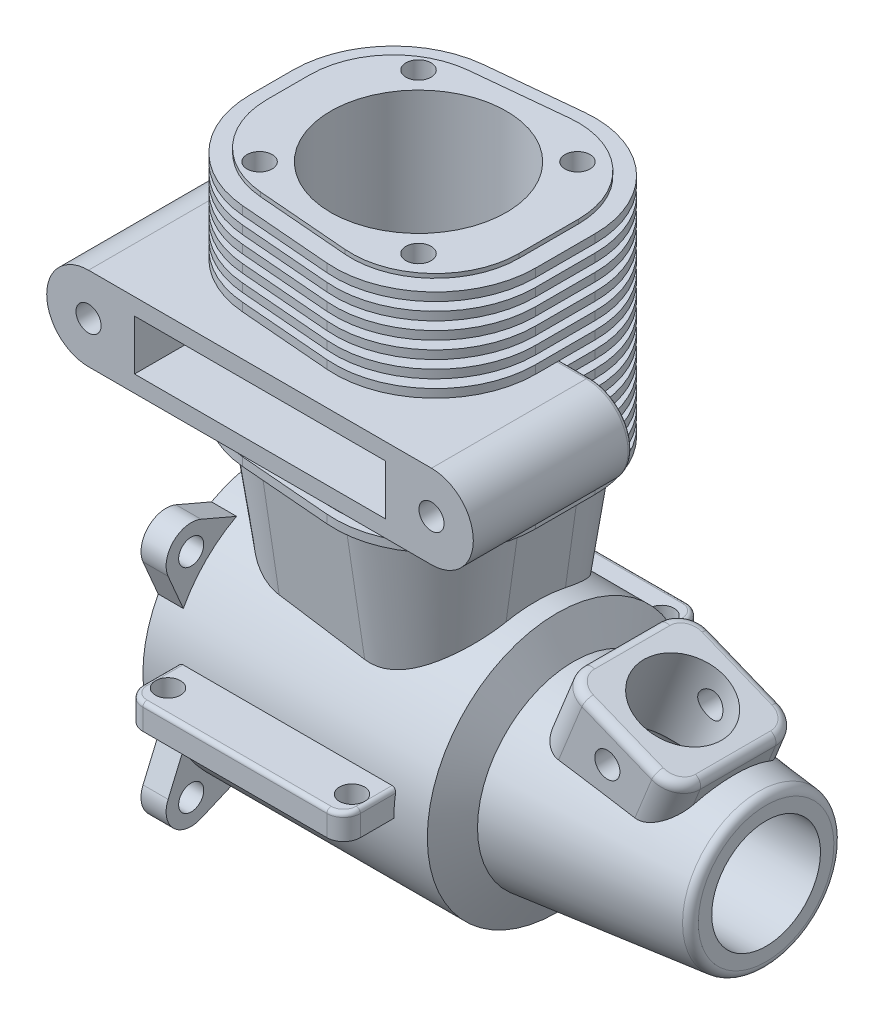
from build123d import *

# Parameters (mm, degrees)
BOSS_EXTRUDE1_DEPTH     = 28
CUT_EXTRUDE1_DEPTH      = 0.5
CUT_EXTRUDE2_DEPTH      = 1
LPATTERN1_COUNT         = 14
LPATTERN1_PITCH         = 2
BOSS_EXTRUDE2_DEPTH     = 20
BOSS_EXTRUDE2_TAPER     = 8.000000000000018
CUT_EXTRUDE3_REACH      = 113.479
CUT_EXTRUDE3_START      = -30
SKETCH6_R               = 14
CUT_EXTRUDE4_REACH      = 79.086
CUT_EXTRUDE4_END_RADIUS = 14
SKETCH7_R               = 10.5
BOSS_EXTRUDE3_DEPTH     = 7.5
CUT_EXTRUDE5_REACH      = 83.479
SKETCH9_R               = 6.5
CUT_EXTRUDE6_REACH      = 55.437
CUT_EXTRUDE6_END_RADIUS = 6.500000000000001
SKETCH10_R              = 5.000000000000001
SKETCH11_R              = 1.5000000000000009
CUT_EXTRUDE7_DEPTH      = 15
BOSS_EXTRUDE4_START     = -3
SKETCH12_R              = 1.5000000000000016
BOSS_EXTRUDE4_DEPTH     = 3
CIRPATTERN1_COUNT       = 4
SKETCH13_W              = 26
SKETCH13_H              = 10.000000000000002
SKETCH13_R              = 1.5000000000000009
SKETCH13_R_2            = 1.499999999999999
BOSS_EXTRUDE5_DEPTH     = 3
CUT_EXTRUDE8_START      = -29
SKETCH14_R              = 14
CUT_EXTRUDE8_DEPTH      = 29
SKETCH15_R              = 1.5000000000000009
SKETCH15_R_2            = 1.4999999999999998
CUT_EXTRUDE9_DEPTH      = 17
BOSS_EXTRUDE6_DEPTH     = 25.5
CUT_EXTRUDE10_REACH     = 79.217
SKETCH19_R              = 1.5000000000000009
CUT_EXTRUDE11_DEPTH     = 19
SKETCH21_R              = 10.5
CUT_EXTRUDE12_DEPTH     = 30
FILLET1_R               = 2
FILLET2_R               = 3
FILLET3_R               = 1
FILLET4_R               = 0.5


with BuildPart() as part:
    # Sketch1 → Revolve1 (revolve)
    with BuildSketch(Plane.XY, mode=Mode.PRIVATE) as revolve1_sk:
        Polygon((29.5, 0), (-29.5, 0), (-29.5, 15.5), (4.5000000000000036, 15.5), (6.499999999999998, 11.5), (29.5, 9), align=None)
    revolve(revolve1_sk.sketch.rotate(Axis((-35, 0, 0), (1, 1.8e-16, 0)), 180), axis=Axis((-35, 0, 0), (1, 1.8e-16, 0)))



with BuildPart() as body_2:
    # Sketch2 → Boss-Extrude1 (new body)
    with BuildSketch(Plane(origin=(0, 26, 0), x_dir=(1, 0, 0), z_dir=(0, 1, 0))):
        with BuildLine():
            Line((5.500000000000006, -3.549349969409107), (5.500000000000006, 3.549349969409107))
            ThreePointArc((5.500000000000007, 3.549349969409107), (1.5516451245829348, 12.447159294618313), (-7.69516846462998, 15.489683814873981))
            Line((-7.69516846462998, 15.489683814873981), (-18.69516846462999, 14.388638125441835))
            ThreePointArc((-18.69516846462999, 14.388638125441835), (-26.39780932520921, 10.49994940455989), (-29.5, 2.4483042799769623))
            Line((-29.5, 2.4483042799769623), (-29.500000000000007, -2.6511662818435284))
            ThreePointArc((-29.500000000000007, -2.6511662818435298), (-26.323804145032504, -10.783846062217727), (-18.476586598315457, -14.611361874558169))
            Line((-18.476586598315457, -14.611361874558165), (-7.4765865983154525, -15.509545562123746))
            ThreePointArc((-7.4765865983154525, -15.509545562123744), (1.6326797803741968, -12.373154114441608), (5.500000000000007, -3.549349969409107))
        make_face()
    extrude(amount=BOSS_EXTRUDE1_DEPTH)

    # Sketch3 → Cut-Extrude1 (cut)
    with BuildSketch(Plane(origin=(0, 54, 0), x_dir=(1, 0, 0), z_dir=(0, 1, 0))):
        with BuildLine():
            Line((-29.500000000000004, 2.4483042799769623), (-29.500000000000004, -2.6511662818435284))
            ThreePointArc((-29.500000000000004, -2.6511662818435284), (-26.323804145032504, -10.783846062217727), (-18.476586598315457, -14.611361874558165))
            Line((-18.476586598315457, -14.611361874558165), (-7.476586598315453, -15.509545562123742))
            ThreePointArc((-7.476586598315453, -15.509545562123742), (1.632679780374196, -12.373154114441608), (5.500000000000002, -3.549349969409108))
            Line((5.500000000000002, -3.549349969409108), (5.500000000000005, 3.5493499694091075))
            ThreePointArc((5.500000000000005, 3.5493499694091075), (1.5516451245829357, 12.447159294618313), (-7.6951684646299805, 15.489683814873983))
            Line((-7.6951684646299805, 15.489683814873983), (-18.69516846462999, 14.388638125441837))
            ThreePointArc((-18.69516846462999, 14.388638125441837), (-26.397809325209206, 10.499949404559894), (-29.500000000000004, 2.4483042799769623))
        make_face()
        with BuildLine():
            Line((-27.500000000000004, 2.4483042799769623), (-27.500000000000004, -2.651166281843529))
            ThreePointArc((-27.500000000000004, -2.651166281843529), (-24.85317012086042, -9.42839943215536), (-18.31382216526288, -12.617995942439057))
            Line((-18.31382216526288, -12.617995942439057), (-7.3138221652628745, -13.516179630004636))
            ThreePointArc((-7.3138221652628745, -13.516179630004636), (0.27723315031183215, -10.902520090269524), (3.5000000000000013, -3.5493499694091106))
            Line((3.5000000000000013, -3.5493499694091106), (3.500000000000005, 3.5493499694091075))
            ThreePointArc((3.500000000000005, 3.5493499694091075), (0.2097042704857799, 10.964191073750113), (-7.495973720524983, 13.49962817396317))
            Line((-7.495973720524983, 13.49962817396317), (-18.495973720524994, 12.398582484531024))
            ThreePointArc((-18.495973720524994, 12.398582484531024), (-24.914841104341008, 9.158008550462737), (-27.500000000000004, 2.4483042799769623))
        make_face(mode=Mode.SUBTRACT)
    extrude(amount=-CUT_EXTRUDE1_DEPTH, mode=Mode.SUBTRACT)

    # Sketch4 → Cut-Extrude2 (cut)
    with BuildSketch(Plane(origin=(0, 52.5, 0), x_dir=(1, 0, 0), z_dir=(0, 1, 0))):
        with BuildLine():
            Line((-29.500000000000004, 2.4483042799769636), (-29.500000000000004, -2.6511662818435284))
            ThreePointArc((-29.500000000000004, -2.6511662818435284), (-26.323804145032504, -10.783846062217727), (-18.476586598315457, -14.611361874558169))
            Line((-18.476586598315457, -14.611361874558169), (-7.476586598315453, -15.509545562123742))
            ThreePointArc((-7.476586598315453, -15.509545562123742), (1.632679780374196, -12.373154114441608), (5.500000000000002, -3.549349969409108))
            Line((5.500000000000002, -3.549349969409108), (5.500000000000005, 3.5493499694091075))
            ThreePointArc((5.500000000000005, 3.5493499694091075), (1.5516451245829375, 12.447159294618313), (-7.695168464629978, 15.489683814873983))
            Line((-7.695168464629978, 15.489683814873983), (-18.69516846462999, 14.388638125441837))
            ThreePointArc((-18.69516846462999, 14.388638125441837), (-26.397809325209206, 10.499949404559894), (-29.500000000000004, 2.4483042799769636))
        make_face()
        with BuildLine():
            Line((-7.49597372052498, 13.49962817396317), (-18.495973720524994, 12.398582484531024))
            ThreePointArc((-18.495973720524994, 12.398582484531024), (-24.914841104341008, 9.158008550462737), (-27.500000000000004, 2.4483042799769636))
            Line((-27.500000000000004, 2.4483042799769636), (-27.500000000000004, -2.651166281843529))
            ThreePointArc((-27.500000000000004, -2.651166281843529), (-24.85317012086042, -9.42839943215536), (-18.31382216526288, -12.617995942439057))
            Line((-18.31382216526288, -12.617995942439057), (-7.3138221652628745, -13.516179630004636))
            ThreePointArc((-7.3138221652628745, -13.516179630004636), (0.27723315031183215, -10.902520090269524), (3.5000000000000013, -3.549349969409108))
            Line((3.5000000000000013, -3.549349969409108), (3.500000000000005, 3.5493499694091075))
            ThreePointArc((3.500000000000005, 3.5493499694091075), (0.20970427048578077, 10.964191073750111), (-7.49597372052498, 13.49962817396317))
        make_face(mode=Mode.SUBTRACT)
    cut_extrude2 = extrude(amount=-CUT_EXTRUDE2_DEPTH, mode=Mode.SUBTRACT)

    # LPattern1: Cut-Extrude2 ×14
    with Locations(*[(0, -i * LPATTERN1_PITCH, 0) for i in range(1, LPATTERN1_COUNT)]):
        add(cut_extrude2, mode=Mode.SUBTRACT)


with BuildPart() as part_1:
    add(part.part)

    add(body_2.part)  # Boss-Extrude2 merges body 2
    # Sketch5 → Boss-Extrude2 (add)
    with BuildSketch(Plane.XZ.offset(-26)):
        with BuildLine():
            Line((3.5000000000000067, -3.5493499694091075), (3.5000000000000013, 3.5493499694091084))
            ThreePointArc((3.5000000000000013, 3.5493499694091084), (0.27723315031183127, 10.902520090269523), (-7.3138221652628745, 13.516179630004634))
            Line((-7.3138221652628745, 13.516179630004634), (-18.31382216526288, 12.617995942439057))
            ThreePointArc((-18.31382216526288, 12.617995942439057), (-24.85317012086042, 9.428399432155356), (-27.5, 2.6511662818435298))
            Line((-27.5, 2.6511662818435298), (-27.500000000000004, -2.448304279976964))
            ThreePointArc((-27.500000000000004, -2.448304279976964), (-24.914841104341008, -9.15800855046274), (-18.495973720524994, -12.398582484531024))
            Line((-18.495973720524994, -12.398582484531024), (-7.495973720524988, -13.49962817396317))
            ThreePointArc((-7.495973720524988, -13.49962817396317), (0.2097042704857799, -10.964191073750115), (3.5000000000000067, -3.5493499694091075))
        make_face()
    extrude(amount=BOSS_EXTRUDE2_DEPTH, taper=BOSS_EXTRUDE2_TAPER)

    # Sketch6 → Cut-Extrude3 (cut, up to next)
    with BuildSketch(Plane(origin=(29.5, 5.42e-15, 0), x_dir=(0, 0, -1), z_dir=(1, 1.8e-16, 0)).offset(CUT_EXTRUDE3_START), mode=Mode.PRIVATE) as cut_extrude3_sk1:
        with Locations(Location((0, 6.43e-15, 0), (0, 0, 90))):
            Circle(SKETCH6_R)
    cut_extrude3_tool1 = extrude(cut_extrude3_sk1.sketch, amount=-CUT_EXTRUDE3_REACH, mode=Mode.PRIVATE) & part_1.part
    add(cut_extrude3_tool1.solids().sort_by_distance((-0.5, 0, 0))[0], mode=Mode.SUBTRACT)

    # Cut-Extrude4: up to this cylinder (the profile starts outside it)
    cut_extrude4_end = Plane(origin=(-11.99999999999999, 4.23e-15, 0), z_dir=(1, 1.8e-16, 0)) * Cylinder(CUT_EXTRUDE4_END_RADIUS, 187.172, mode=Mode.PRIVATE)
    # Sketch7 → Cut-Extrude4 (cut, up to the surface)
    with BuildSketch(Plane(origin=(0, 54, 0), x_dir=(1, 0, 0), z_dir=(0, 1, 0)), mode=Mode.PRIVATE) as cut_extrude4_sk1:
        with Locations(Location((-11.999999999999996, -0.05071550046664143, 0), (0, 0, 270))):
            Circle(SKETCH7_R)
    cut_extrude4_tool1 = extrude(cut_extrude4_sk1.sketch, amount=-CUT_EXTRUDE4_REACH, mode=Mode.PRIVATE) - cut_extrude4_end
    add(cut_extrude4_tool1.solids().sort_by_distance((-12, 54, 0.050716))[0], mode=Mode.SUBTRACT)

    # Sketch8 → Boss-Extrude3 (add, symmetric)
    with BuildSketch(Plane.XY):
        Polygon((12.56995580610051, 16.83117272136498), (26.477713624602313, 11.212073820126292), (23.255986455181947, 3.2380192577998512), (8.41447354919115, 6.545993217683963), align=None)
    extrude(amount=BOSS_EXTRUDE3_DEPTH, both=True)

    # Sketch9 → Cut-Extrude5 (cut, up to next)
    with BuildSketch(Plane(origin=(29.5, 5.42e-15, 0), x_dir=(0, 0, -1), z_dir=(1, 1.8e-16, 0)), mode=Mode.PRIVATE) as cut_extrude5_sk1:
        with Locations(Location((0, 6.43e-15, 0), (0, 0, 90))):
            Circle(SKETCH9_R)
    cut_extrude5_tool1 = extrude(cut_extrude5_sk1.sketch, amount=-CUT_EXTRUDE5_REACH, mode=Mode.PRIVATE) & part_1.part
    add(cut_extrude5_tool1.solids().sort_by_distance((29.5, 0, 0))[0], mode=Mode.SUBTRACT)

    # Cut-Extrude6: up to this cylinder (the profile starts outside it)
    cut_extrude6_end = Plane(origin=(19.523835, 1.002e-14, 0), z_dir=(1, 1.8e-16, 0)) * Cylinder(CUT_EXTRUDE6_END_RADIUS, 124.874, mode=Mode.PRIVATE)
    # Sketch10 → Cut-Extrude6 (cut, up to the surface)
    with BuildSketch(Plane(origin=(7.609900660905927, 18.83516508161221, 0), x_dir=(0.9271838545667873, -0.3746065934159126, 0), z_dir=(0.3746065934159126, 0.9271838545667873, 0)), mode=Mode.PRIVATE) as cut_extrude6_sk1:
        with Locations(Location((12.849591799689073, 0, 0), (0, 0, 180))):
            Circle(SKETCH10_R)
    cut_extrude6_tool1 = extrude(cut_extrude6_sk1.sketch, amount=-CUT_EXTRUDE6_REACH, mode=Mode.PRIVATE) - cut_extrude6_end
    add(cut_extrude6_tool1.solids().sort_by_distance((19.523835, 14.021623, 0))[0], mode=Mode.SUBTRACT)

    # Sketch11 → Cut-Extrude7 (cut)
    with BuildSketch(Plane(origin=(0, 0, -7.5), x_dir=(-1, 0, 0), z_dir=(0, 0, -1))):
        with Locations((-18.02540834168776, 10.312887852478488)):
            Circle(SKETCH11_R)
    extrude(amount=-CUT_EXTRUDE7_DEPTH, mode=Mode.SUBTRACT)

    # Sketch12 → Boss-Extrude4 (add)
    with BuildSketch(Plane.ZY.offset(29.5).offset(BOSS_EXTRUDE4_START)):
        with BuildLine():
            Line((11.547196525706605, 15.485799362736687), (7.306107966362196, 13.670068997040902))
            ThreePointArc((7.306107966362196, 13.670068997040902), (10.96015510839159, 10.96015510839136), (13.670068997041053, 7.306107966361906))
            Line((13.670068997041053, 7.306107966361906), (15.485799362736865, 11.547196525706363))
            ThreePointArc((15.485799362736865, 11.547196525706363), (14.84924240491766, 14.849242404917474), (11.547196525706605, 15.485799362736687))
        make_face()
        with Locations(Location((12.72792206135792, 12.727922061357795, 0), (0, 0, 270))):
            Circle(SKETCH12_R, mode=Mode.SUBTRACT)
    boss_extrude4 = extrude(amount=BOSS_EXTRUDE4_DEPTH)

    # CirPattern1: Boss-Extrude4 ×4 about axis
    cirpattern1_axis = Axis((0, 1.004e-14, -1.359e-14), (1, 0, 0))
    for i in range(1, CIRPATTERN1_COUNT):
        add(boss_extrude4.rotate(cirpattern1_axis, i * 360 / CIRPATTERN1_COUNT))

    # Sketch13 → Boss-Extrude5 (add)
    with BuildSketch(Plane(origin=(0, 0, 0), x_dir=(1, 0, 0), z_dir=(0, 1, 0))):
        with Locations((-12.499999999999996, 16.5)):
            Rectangle(SKETCH13_W, SKETCH13_H)
        with Locations(Location((-23.499999999999993, 18.5, 0), (0, 0, 270))):
            Circle(SKETCH13_R, mode=Mode.SUBTRACT)
        with Locations(Location((-1.4999999999999978, 18.5, 0), (0, 0, 90))):
            Circle(SKETCH13_R_2, mode=Mode.SUBTRACT)
    boss_extrude5 = extrude(amount=BOSS_EXTRUDE5_DEPTH)

    # Sketch14 → Cut-Extrude8 (cut)
    with BuildSketch(Plane.ZY.offset(29.5).offset(CUT_EXTRUDE8_START)):
        with Locations(Location((0, 6.43e-15, 0), (0, 0, 90))):
            Circle(SKETCH14_R)
    cut_extrude8 = extrude(amount=CUT_EXTRUDE8_DEPTH, mode=Mode.SUBTRACT)

    # Mirror2: Boss-Extrude5, Cut-Extrude8 across plane
    add(boss_extrude5.mirror(Plane.XY))
    add(cut_extrude8.mirror(Plane.XY), mode=Mode.SUBTRACT)

    # Sketch15 → Cut-Extrude9 (cut)
    with BuildSketch(Plane(origin=(0, 54, 0), x_dir=(1, 0, 0), z_dir=(0, 1, 0))):
        with Locations(Location((-21.499999999999996, 9.44928449953336, 0), (0, 0, 270))):
            Circle(SKETCH15_R)
        with Locations(Location((-2.499999999999995, 9.449284499533363, 0), (0, 0, 270))):
            Circle(SKETCH15_R_2)
        with Locations(Location((-2.499999999999995, -9.550715500466637, 0), (0, 0, 270))):
            Circle(SKETCH15_R_2)
        with Locations(Location((-21.499999999999996, -9.550715500466639, 0), (0, 0, 270))):
            Circle(SKETCH15_R)
    extrude(amount=-CUT_EXTRUDE9_DEPTH, mode=Mode.SUBTRACT)

    # Sketch18 → Boss-Extrude6 (add, symmetric)
    with BuildSketch(Plane.ZY.offset(11.999999999999996)):
        Polygon((19, 31.999999999999993), (0, 31.999999999999993), (0, 42), (19, 41.99999999999999), align=None)
    extrude(amount=BOSS_EXTRUDE6_DEPTH, both=True)

    # Sketch19 → Cut-Extrude10 (cut, up to next)
    with BuildSketch(Plane.XY.offset(19), mode=Mode.PRIVATE) as cut_extrude10_sk1:
        with BuildLine():
            Line((13.499999999999995, 42), (8.499999999999996, 42))
            ThreePointArc((8.499999999999996, 42.00000000000001), (12.035533899261628, 40.53553391260386), (13.500000000000007, 37.00000001886876))
            Line((13.499999999999995, 37.00000001886876), (13.499999999999995, 42))
        make_face()
    cut_extrude10_tool1 = extrude(cut_extrude10_sk1.sketch, amount=-CUT_EXTRUDE10_REACH, mode=Mode.PRIVATE) & part_1.part
    # Sketch19 → Cut-Extrude10 (cut, up to next)
    with BuildSketch(Plane.XY.offset(19), mode=Mode.PRIVATE) as cut_extrude10_sk2:
        with BuildLine():
            Line((13.499999999999996, 32), (13.499999999999995, 37.00000001886876))
            ThreePointArc((13.500000000000007, 37.00000001886876), (12.035533912603855, 33.46446610073837), (8.499999999999993, 31.999999999999993))
            Line((8.499999999999993, 31.999999999999993), (13.499999999999996, 32))
        make_face()
    cut_extrude10_tool2 = extrude(cut_extrude10_sk2.sketch, amount=-CUT_EXTRUDE10_REACH, mode=Mode.PRIVATE) & part_1.part
    # Sketch19 → Cut-Extrude10 (cut, up to next)
    with BuildSketch(Plane.XY.offset(19), mode=Mode.PRIVATE) as cut_extrude10_sk3:
        with BuildLine():
            ThreePointArc((-37.500000000000014, 36.99999995060091), (-36.03553395543859, 40.53553385642687), (-32.500000090624596, 41.99999999999997))
            Line((-32.500000090624596, 41.99999999999997), (-37.50000000000001, 41.99999999999999))
            Line((-37.50000000000001, 41.99999999999999), (-37.5, 36.99999995060091))
        make_face()
    cut_extrude10_tool3 = extrude(cut_extrude10_sk3.sketch, amount=-CUT_EXTRUDE10_REACH, mode=Mode.PRIVATE) & part_1.part
    # Sketch19 → Cut-Extrude10 (cut, up to next)
    with BuildSketch(Plane.XY.offset(19), mode=Mode.PRIVATE) as cut_extrude10_sk4:
        with BuildLine():
            ThreePointArc((-32.50000009062453, 31.999999999999982), (-36.03553392050814, 33.46446610864264), (-37.500000000000014, 36.99999995060091))
            Line((-37.5, 36.99999995060091), (-37.5, 31.999999999999993))
            Line((-37.5, 31.999999999999993), (-32.50000009062453, 31.999999999999993))
        make_face()
    cut_extrude10_tool4 = extrude(cut_extrude10_sk4.sketch, amount=-CUT_EXTRUDE10_REACH, mode=Mode.PRIVATE) & part_1.part
    # Sketch19 → Cut-Extrude10 (cut, up to next)
    with BuildSketch(Plane.XY.offset(19), mode=Mode.PRIVATE) as cut_extrude10_sk5:
        with Locations((-32.5, 36.99999999999999)):
            Circle(SKETCH19_R)
    cut_extrude10_tool5 = extrude(cut_extrude10_sk5.sketch, amount=-CUT_EXTRUDE10_REACH, mode=Mode.PRIVATE) & part_1.part
    # Sketch19 → Cut-Extrude10 (cut, up to next)
    with BuildSketch(Plane.XY.offset(19), mode=Mode.PRIVATE) as cut_extrude10_sk6:
        with Locations((8.499999999999993, 37.00000000000001)):
            Circle(SKETCH19_R)
    cut_extrude10_tool6 = extrude(cut_extrude10_sk6.sketch, amount=-CUT_EXTRUDE10_REACH, mode=Mode.PRIVATE) & part_1.part
    add(cut_extrude10_tool1.solids().sort_by_distance((12.38316, 40.88316, 19))[0], mode=Mode.SUBTRACT)
    add(cut_extrude10_tool2.solids().sort_by_distance((12.38316, 33.11684, 19))[0], mode=Mode.SUBTRACT)
    add(cut_extrude10_tool3.solids().sort_by_distance((-36.38316, 40.88316, 19))[0], mode=Mode.SUBTRACT)
    add(cut_extrude10_tool4.solids().sort_by_distance((-36.38316, 33.11684, 19))[0], mode=Mode.SUBTRACT)
    add(cut_extrude10_tool5.solids().sort_by_distance((-32.5, 37, 19))[0], mode=Mode.SUBTRACT)
    add(cut_extrude10_tool6.solids().sort_by_distance((8.5, 37, 19))[0], mode=Mode.SUBTRACT)

    # Sketch20 → Cut-Extrude11 (cut)
    with BuildSketch(Plane.XY.offset(19)):
        Polygon((2.9999999999999907, 33.99999999999999), (-27.00000000000001, 33.99999999999999), (-27.00000000000001, 39.99999999999999), (2.9999999999999907, 40), align=None)
    extrude(amount=-CUT_EXTRUDE11_DEPTH, mode=Mode.SUBTRACT)

    # Sketch21 → Cut-Extrude12 (cut)
    with BuildSketch(Plane(origin=(0, 54, 0), x_dir=(1, 0, 0), z_dir=(0, 1, 0))):
        with Locations(Location((-11.999999999999996, -0.05071550046664143, 0), (0, 0, 270))):
            Circle(SKETCH21_R)
    extrude(amount=-CUT_EXTRUDE12_DEPTH, mode=Mode.SUBTRACT)

    # Fillet1
    fillet1_edges = [part_1.edges().sort_by_distance(p)[0] for p in [
        (-25.499999999999996, 1.5, -21.5),
        (0.5000000000000039, 1.5, -21.5),
        (-25.499999999999996, 1.5, 21.5),
        (0.5000000000000039, 1.5, 21.5),
    ]]
    fillet(fillet1_edges, radius=FILLET1_R)

    # Fillet2
    fillet2_edges = [part_1.edges().sort_by_distance(p)[0] for p in [
        (25.410471508665278, 8.570556889558352, 7.5),
        (10.85380917143942, 12.583560747380702, 7.5),
        (10.85380917143942, 12.583560747380702, -7.5),
        (25.41047150866528, 8.570556889558354, -7.5),
    ]]
    fillet(fillet2_edges, radius=FILLET2_R)

    # Fillet3
    fillet3_edges = [part_1.edges().sort_by_distance(p)[0] for p in [
        (29.5, 9.000000000000002, -2.2e-15),
        (19.523834715351413, 14.021623270745636, 7.5),
        (19.523834715351413, 14.021623270745636, -7.5),
        (12.56995580610051, 16.83117272136498, 0),
        (26.477713624602313, 11.212073820126292, 0),
        (25.663016033814525, 11.541233012929279, -6.621320343559642),
        (13.3846533968883, 16.502013528561992, -6.621320343559643),
        (13.3846533968883, 16.502013528561992, 6.621320343559643),
        (25.663016033814525, 11.541233012929279, 6.621320343559642),
    ]]
    fillet(fillet3_edges, radius=FILLET3_R)

    # Fillet4
    fillet4_edges = [part_1.edges().sort_by_distance(p)[0] for p in [
        (-30.000000045312298, 41.99999999999999, 0),
        (-30.00000004531227, 31.999999999999986, 0),
        (5.999999999999993, 31.999999999999996, 0),
        (13.500000000000005, 37.00000000000001, 0),
        (0.5000000000000039, 3, 17.353453162872775),
        (-0.08578643762690041, 3, 20.914213562373096),
        (-25.499999999999996, 3, 17.353453162872775),
        (-24.914213562373092, 3, 20.914213562373096),
        (0.5000000000000039, 3, -17.353453162872775),
        (-0.08578643762690086, 3, -20.914213562373096),
        (-25.499999999999996, 3, -17.353453162872775),
        (-24.914213562373092, 3, -20.914213562373096),
        (-37.500000000000014, 36.99999999999995, 0),
        (5.999999999999993, 42, 0),
        (-12.499999999999996, 3, 21.5),
        (-12.499999999999996, 3, -21.5),
    ]]
    fillet(fillet4_edges, radius=FILLET4_R)


solid = part_1.part
